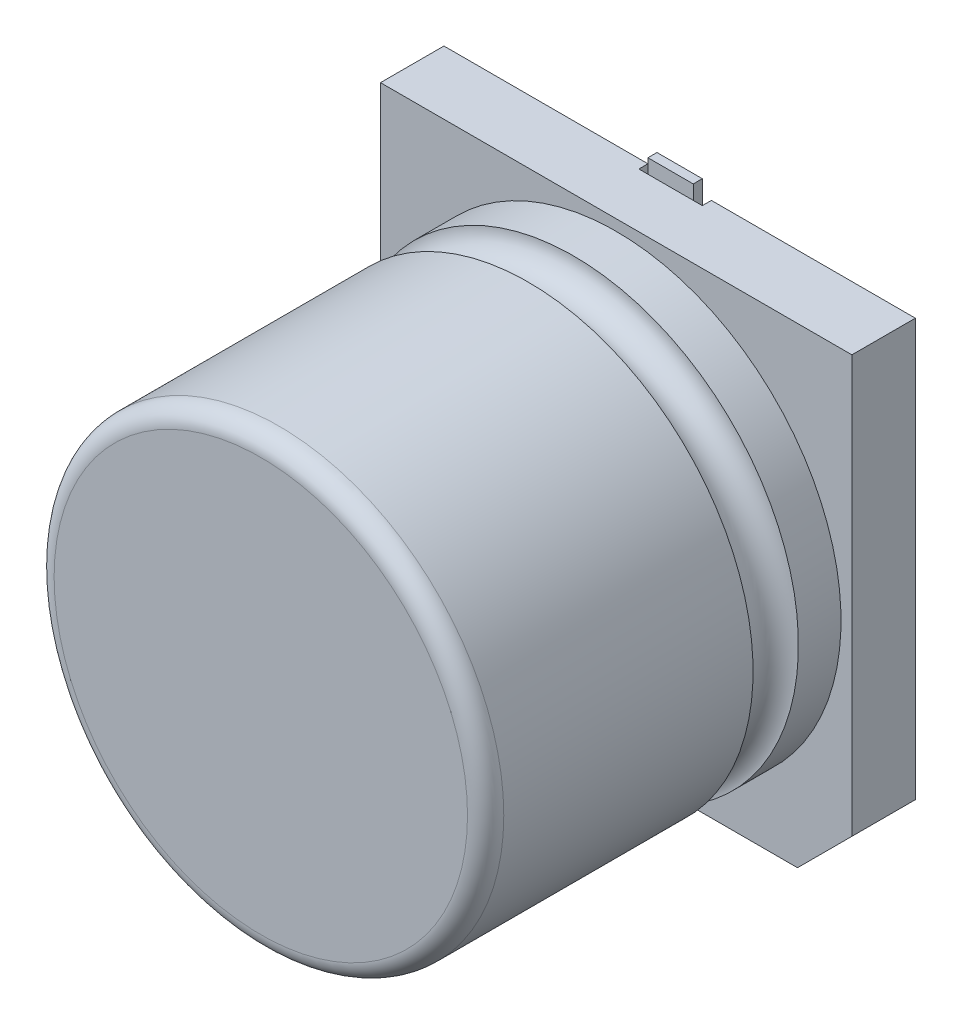
from build123d import *

# Parameters (mm, degrees)
SKETCH1_W           = 6.604
SKETCH1_H           = 6.604
BOSS_EXTRUDE1_DEPTH = 0.889
FILLET1_R           = 0.254
CHAMFER1_SIZE       = 0.762
SKETCH4_W           = 0.889
SKETCH4_H           = 2.4003
CUT_EXTRUDE1_DEPTH  = 0.127
BASE_FLANGE1_DEPTH  = 0.3175


# Sheet-metal steps are written as plain solids
with BuildPart() as part:
    # Sketch1 → Boss-Extrude1 (new body)
    with BuildSketch(Plane.XY):
        with Locations((3.302, 3.302)):
            Rectangle(SKETCH1_W, SKETCH1_H)
    extrude(amount=BOSS_EXTRUDE1_DEPTH)

    # Sketch2 → Revolve1 (revolve)
    with BuildSketch(Plane(origin=(3.302, 0, 0), x_dir=(0, 0, -1), z_dir=(1, 0, 0)), mode=Mode.PRIVATE) as revolve1_sk:
        with BuildLine():
            Line((-0.889, 3.302), (-5.8674, 3.302))
            Line((-5.8674, 3.302), (-5.8674, 6.4516))
            Line((-5.8674, 6.4516), (-2.1209, 6.4516))
            ThreePointArc((-2.1209, 6.4516), (-1.8034, 6.1341), (-1.4859, 6.4516))
            Line((-1.4859, 6.4516), (-0.889, 6.4516))
            Line((-0.889, 6.4516), (-0.889, 3.302))
        make_face()
    revolve(revolve1_sk.sketch.rotate(Axis((3.302, 3.302, -6.0452), (0, 0, 1)), 90), axis=Axis((3.302, 3.302, -6.0452), (0, 0, 1)))

    # Fillet1
    fillet1_edges = [part.edges().sort_by_distance(p)[0] for p in [
        (6.4516, 3.302, 5.8674),
    ]]
    fillet(fillet1_edges, radius=FILLET1_R)

    # Chamfer1
    chamfer1_edges = [part.edges().sort_by_distance(p)[0] for p in [
        (6.604, 0, 0.4445),
        (0, 0, 0.4445),
    ]]
    chamfer(chamfer1_edges, length=CHAMFER1_SIZE)

    # Sketch4 → Cut-Extrude1 (cut)
    with BuildSketch(Plane(origin=(0, 0, 0), x_dir=(-1, 0, 0), z_dir=(0, 0, -1))):
        with Locations((-3.302, 5.40385)):
            Rectangle(SKETCH4_W, SKETCH4_H)
        with Locations((-3.302, 1.20015)):
            Rectangle(SKETCH4_W, SKETCH4_H)
    extrude(amount=-CUT_EXTRUDE1_DEPTH, mode=Mode.SUBTRACT)


with BuildPart() as body_2:
    # Sketch5 → Base-Flange1 (new, symmetric)
    with BuildSketch(Plane(origin=(3.302, 0, 0), x_dir=(0, 0, -1), z_dir=(1, 0, 0))):
        with BuildLine():
            Line((-0.201114098, 2.390695998), (-0.1524, 2.390695998))
            ThreePointArc((-0.1524, 2.390695998), (-0.044636927, 2.346059072), (0, 2.238295998))
            Line((0, 2.238295998), (0, -0.200104002))
            Line((0, -0.200104002), (-0.127, -0.200104002))
            Line((-0.127, -0.200104002), (-0.127, 2.238295998))
            ThreePointArc((-0.127, 2.238295998), (-0.134439488, 2.25625651), (-0.1524, 2.263695998))
            Line((-0.1524, 2.263695998), (-0.201114098, 2.263695998))
            Line((-0.201114098, 2.263695998), (-0.201114098, 2.390695998))
        make_face()
    extrude(amount=BASE_FLANGE1_DEPTH, both=True)


with BuildPart() as body_3:
    # Mirror1: mirrored copy
    add(body_2.part.mirror(Plane(origin=(0, 3.302, 0), x_dir=(0, 0, 1), z_dir=(0, -1, 0))))


solid = Compound([part.part, body_2.part, body_3.part])
